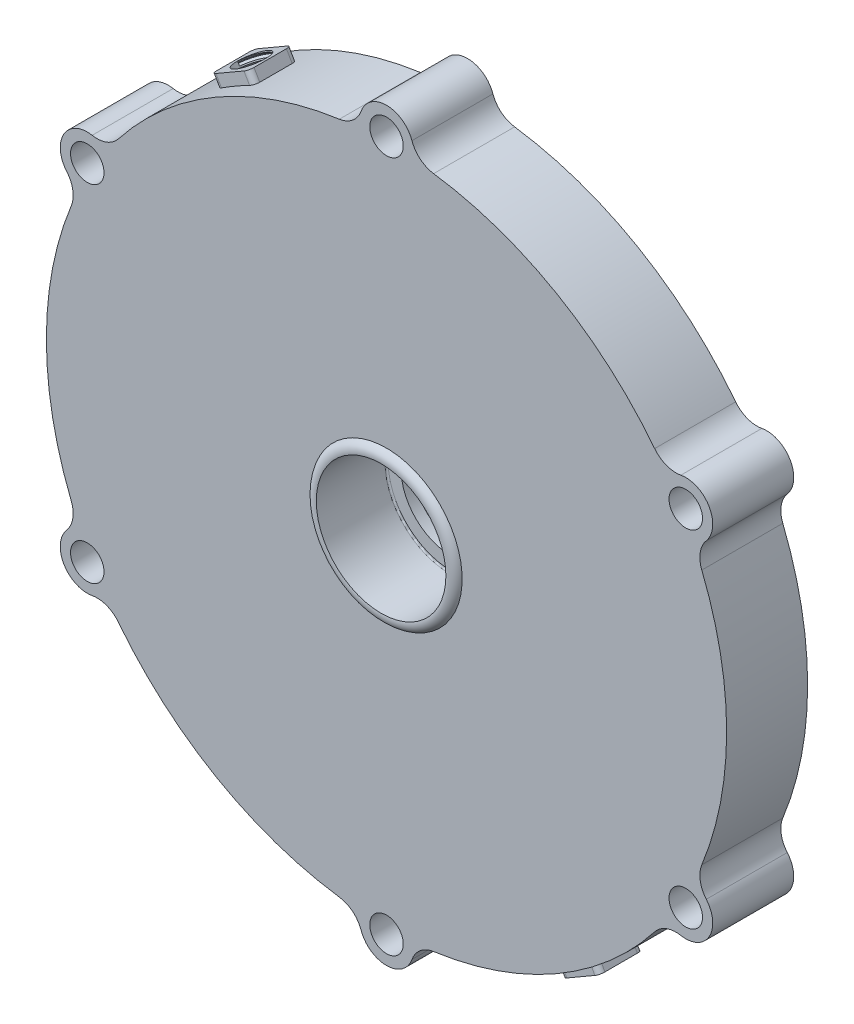
from build123d import *

# Parameters (mm, degrees)
BOSS_EXTRUDE2_DEPTH      = 2
SKETCH9_R                = 3
CUT_EXTRUDE10_DEPTH      = 11
THREAD6_PITCH            = 1
CIRPATTERN1_COUNT        = 2
SKETCH4_R                = 5
SKETCH4_R_2              = 3.1
BOSS_EXTRUDE3_DEPTH      = 15
SKETCH11_R               = 3.1
CUT_EXTRUDE4_DEPTH       = 15
FILLET2_R                = 5
CIRPATTERN2_COUNT        = 6
FILLET2_OF_CIRPATTERN2_R = 5
CUT_EXTRUDE5_START       = -1
SKETCH13_R               = 12
CUT_EXTRUDE5_DEPTH       = 1
FILLET3_R                = 0.3


with BuildPart() as part:
    # Sketch2 → Revolve1 (revolve)
    with BuildSketch(Plane(origin=(0, 0, 0), x_dir=(0, 0, -1), z_dir=(1, 0, 0)), mode=Mode.PRIVATE) as revolve1_sk:
        with BuildLine():
            Line((-1.839622642, 63), (-16.839622642, 63))
            Line((-16.839622642, 63), (-16.839622642, 13))
            Line((-16.839622642, 13), (-16.839622642, 12))
            Line((-16.839622642, 12), (-15.839622642, 12))
            Line((-15.839622642, 12), (-13.839622642, 12))
            Line((-13.839622642, 12), (-4.839622642, 12))
            Line((-4.839622642, 12), (-4.839622642, 9.314773991))
            Line((-4.839622642, 9.314773991), (-2.839622642, 9.314773991))
            Line((-2.839622642, 9.314773991), (-2.839622642, 14))
            ThreePointArc((-2.839622642, 14), (-3.13251586, 14.707106781), (-3.839622642, 15))
            Line((-3.839622642, 15), (-4.639622642, 15))
            Line((-4.639622642, 15), (-4.639622642, 14.3))
            Line((-4.639622642, 14.3), (-5.939622642, 14.3))
            Line((-5.939622642, 14.3), (-5.939622642, 15))
            Line((-5.939622642, 15), (-12.839622642, 15))
            Line((-12.839622642, 15), (-13.839622642, 16))
            Line((-13.839622642, 16), (-13.839622642, 57))
            ThreePointArc((-13.839622642, 57), (-13.546729423, 57.707106781), (-12.839622642, 58))
            Line((-12.839622642, 58), (-1.839622642, 58))
            Line((-1.839622642, 58), (-1.839622642, 63))
        make_face()
    revolve(revolve1_sk.sketch.rotate(Axis((0, 0, 66.5), (0, 0, -1)), 90), axis=Axis((0, 0, 66.5), (0, 0, -1)))

    # Sketch8 → Boss-Extrude2 (add, symmetric)
    with BuildSketch(Plane(origin=(31.5, -54.559600438, 0), x_dir=(0, 0, 1), z_dir=(0.500000000000001, -0.866025403784438, 0))):
        with BuildLine():
            Line((6.339622642, -4), (12.339622642, -4))
            ThreePointArc((12.339622642, -4), (13.046729423, -3.707106781), (13.339622642, -3))
            Line((13.339622642, -3), (13.339622642, 3))
            ThreePointArc((13.339622642, 3), (13.046729423, 3.707106781), (12.339622642, 4))
            Line((12.339622642, 4), (6.339622642, 4))
            ThreePointArc((6.339622642, 4), (5.63251586, 3.707106781), (5.339622642, 3))
            Line((5.339622642, 3), (5.339622642, -3))
            ThreePointArc((5.339622642, -3), (5.63251586, -3.707106781), (6.339622642, -4))
        make_face()
    boss_extrude2 = extrude(amount=BOSS_EXTRUDE2_DEPTH, both=True)

    # Sketch9 → Cut-Extrude10 (cut)
    with BuildSketch(Plane(origin=(32.5, -56.291651246, 0), x_dir=(0, 0, 1), z_dir=(0.500000000000001, -0.866025403784438, 0))):
        with Locations(Location((9.339622642, 0, 0), (0, 0, 270))):
            Circle(SKETCH9_R)
    cut_extrude10 = extrude(amount=-CUT_EXTRUDE10_DEPTH, mode=Mode.SUBTRACT)

    # Thread6: the profile of Thread Profile9 profile screwed along a right-hand helix of 10 turns, 8 arcs to a turn; built about Z, then put on its axis
    thread6_z = Axis((0, 0, 0), (0, 0, 1))
    thread6_corners = [(2.9997, 0, -0.000173205), (3.541265875, 0, 0.312499999), (3.541265875, 0, 0.437499999), (2.9997, 0, 0.750173203)]
    with BuildLine(mode=Mode.PRIVATE) as thread6_profile:
        Line(thread6_corners[0], thread6_corners[1])
        Line(thread6_corners[1], thread6_corners[2])
        Line(thread6_corners[2], thread6_corners[3])
        Line(thread6_corners[3], thread6_corners[0])
    thread6_cap = Face(thread6_profile.wire())
    thread6_turn_angles = [0, 22.5, 45, 67.5, 90, 112.5, 135, 157.5, 180, 202.5, 225, 247.5, 270, 292.5, 315, 337.5, 360]
    thread6_turn_weights = [1, 0.9238795325112867, 1, 0.9238795325112867, 1, 0.9238795325112867, 1, 0.9238795325112867, 1, 0.9238795325112867, 1, 0.9238795325112867, 1, 0.9238795325112867, 1, 0.9238795325112867, 1]
    thread6_turn_rails = [Edge.make_bspline([Vector(p[0], p[1], 0).rotate(thread6_z, thread6_turn_angles[k]) / thread6_turn_weights[k] + Vector(0, 0, p[2] + THREAD6_PITCH * thread6_turn_angles[k] / 360) for k in range(17)], [0, 0, 0, 1, 1, 2, 2, 3, 3, 4, 4, 5, 5, 6, 6, 7, 7, 8, 8, 8], 2, thread6_turn_weights) for p in thread6_corners]
    thread6_turn_sides = [Face.make_surface_from_curves(thread6_turn_rails[p[0]], thread6_turn_rails[p[1]]) for p in [(0, 1), (1, 2), (2, 3), (3, 0)]]
    thread6 = Plane(origin=(32.5, -56.291651246, 9.339622642), x_dir=(0.866025404, 0.5, 0), z_dir=(-0.5, 0.866025404, 0)) * Solid(Shell([*[p.moved(Location((0, 0, THREAD6_PITCH * i))) for i in range(10) for p in thread6_turn_sides], thread6_cap, thread6_cap.rotate(thread6_z, 3600).moved(Location((0, 0, THREAD6_PITCH * 3600 / 360)))]))
    add(thread6, mode=Mode.SUBTRACT)

    # CirPattern1: Boss-Extrude2, Cut-Extrude10, Thread6 ×2 about axis
    cirpattern1_axis = Axis((0, 0, 66.5), (0, 0, 1))
    add([boss_extrude2.rotate(cirpattern1_axis, i * 360 / CIRPATTERN1_COUNT) for i in range(1, CIRPATTERN1_COUNT)])
    add([cut_extrude10.rotate(cirpattern1_axis, i * 360 / CIRPATTERN1_COUNT) for i in range(1, CIRPATTERN1_COUNT)], mode=Mode.SUBTRACT)
    add([thread6.rotate(cirpattern1_axis, i * 360 / CIRPATTERN1_COUNT) for i in range(1, CIRPATTERN1_COUNT)], mode=Mode.SUBTRACT)

    # Sketch4 → Boss-Extrude3 (add)
    with BuildSketch(Plane(origin=(0, 0, 1.839622642), x_dir=(-1, 0, 0), z_dir=(0, 0, -1))):
        with Locations((0, 64)):
            Circle(SKETCH4_R)
        with Locations((0, 64)):
            Circle(SKETCH4_R_2, mode=Mode.SUBTRACT)
    boss_extrude3 = extrude(amount=-BOSS_EXTRUDE3_DEPTH)

    # Sketch11 → Cut-Extrude4 (cut)
    with BuildSketch(Plane(origin=(0, 0, 1.839622642), x_dir=(-1, 0, 0), z_dir=(0, 0, -1))):
        with Locations((0, 64)):
            Circle(SKETCH11_R)
    cut_extrude4 = extrude(amount=-CUT_EXTRUDE4_DEPTH, mode=Mode.SUBTRACT)

    # Fillet2
    fillet2_edges = [part.edges().sort_by_distance(p)[0] for p in [
        (-4.856937693, 62.8125, 9.339622642),
        (4.856937693, 62.8125, 9.339622642),
    ]]
    fillet(fillet2_edges, radius=FILLET2_R)

    # CirPattern2: Boss-Extrude3, Cut-Extrude4 ×6 about axis
    cirpattern2_axis = Axis((0, 0, 0), (0, 0, 1))
    add([boss_extrude3.rotate(cirpattern2_axis, i * 360 / CIRPATTERN2_COUNT) for i in range(1, CIRPATTERN2_COUNT)])
    add([cut_extrude4.rotate(cirpattern2_axis, i * 360 / CIRPATTERN2_COUNT) for i in range(1, CIRPATTERN2_COUNT)], mode=Mode.SUBTRACT)

    # Fillet2 of CirPattern2
    fillet2_of_cirpattern2_edges = [part.edges().sort_by_distance(p)[0] for p in [
        (-56.825689522, 27.200018574, 9.339622642),
        (-51.968751829, 35.612481426, 9.339622642),
        (-51.968751829, -35.612481426, 9.339622642),
        (-56.825689522, -27.200018574, 9.339622642),
        (4.856937693, -62.8125, 9.339622642),
        (-4.856937693, -62.8125, 9.339622642),
        (56.825689522, -27.200018574, 9.339622642),
        (51.968751829, -35.612481426, 9.339622642),
        (51.968751829, 35.612481426, 9.339622642),
        (56.825689522, 27.200018574, 9.339622642),
    ]]
    fillet(fillet2_of_cirpattern2_edges, radius=FILLET2_OF_CIRPATTERN2_R)

    # Sketch12 → Revolve2 (revolve)
    with BuildSketch(Plane(origin=(0, 0, 0), x_dir=(1, 0, 0), z_dir=(0, 1, 0)), mode=Mode.PRIVATE) as revolve2_sk:
        with BuildLine():
            Line((12, -16.839622642), (14.008160386, -16.839622642))
            ThreePointArc((14.008160386, -16.839622642), (13.18042641, -17.693754129), (12, -17.839622642))
            Line((12, -17.839622642), (0, -17.839622642))
            Line((0, -17.839622642), (0, -16.839622642))
            Line((0, -16.839622642), (12, -16.839622642))
        make_face()
    revolve(revolve2_sk.sketch.rotate(Axis((0, 0, 16.839622642), (0, 0, 1)), 180), axis=Axis((0, 0, 16.839622642), (0, 0, 1)))

    # Sketch13 → Cut-Extrude5 (cut)
    with BuildSketch(Plane.XY.offset(17.839622642).offset(CUT_EXTRUDE5_START)):
        Circle(SKETCH13_R)
    extrude(amount=CUT_EXTRUDE5_DEPTH, mode=Mode.SUBTRACT)

    # Fillet3
    fillet3_edges = [part.edges().sort_by_distance(p)[0] for p in [
        (-12, 0, 4.839622642),
    ]]
    fillet(fillet3_edges, radius=FILLET3_R)


solid = part.part
